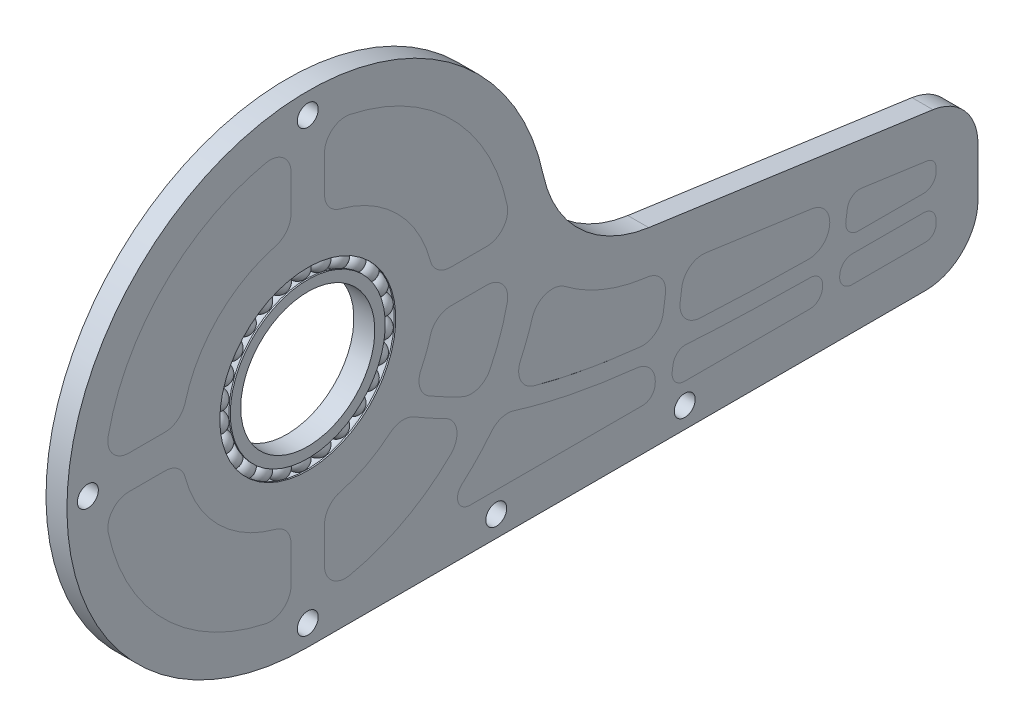
from build123d import *
from OCP.BRepFilletAPI import BRepFilletAPI_MakeFillet

# Parameters (mm, degrees)
SKETCH1_R           = 23.5
SKETCH1_R_2         = 2.5
BOSS_EXTRUDE1_DEPTH = 5
CUT_EXTRUDE1_DEPTH  = 171.091886932
FILLET1_R1          = 5
FILLET1_R2          = 3
BOSS_EXTRUDE2_DEPTH = 5
CIRPATTERN1_COUNT   = 26


# Read off the part's stored shape, not the designer's step: Boss-Extrude2
with BuildPart() as part:
    # Sketch1 → Boss-Extrude1 (new body)
    with BuildSketch(Plane(origin=(0, 0, 0), x_dir=(0, 0, -1), z_dir=(1, 0, 0))):
        with BuildLine():
            Line((0, -57.5), (147.5, -57.5))
            ThreePointArc((147.5, -57.5), (156.338834765, -53.838834765), (160, -45))
            Line((160, -45), (160, -33.365178619))
            ThreePointArc((160, -33.365178619), (156.934208165, -25.164830072), (149.240685392, -20.986971383))
            Line((149.240685392, -20.986971383), (81.395536862, -11.446247371))
            ThreePointArc((81.395536862, -11.446247371), (65.121194516, -3.68658445), (56.233805186, 12.000381425))
            ThreePointArc((56.233805186, 12.000381425), (-44.700514158, 36.16785913), (0, -57.5))
        make_face()
        Circle(SKETCH1_R, mode=Mode.SUBTRACT)
        with Locations((0, 52.5)):
            Circle(SKETCH1_R_2, mode=Mode.SUBTRACT)
        with Locations((-52.5, 0)):
            Circle(SKETCH1_R_2, mode=Mode.SUBTRACT)
        with Locations((0, -52.5)):
            Circle(SKETCH1_R_2, mode=Mode.SUBTRACT)
        with Locations((45, -52.5)):
            Circle(SKETCH1_R_2, mode=Mode.SUBTRACT)
        with Locations((90, -52.5)):
            Circle(SKETCH1_R_2, mode=Mode.SUBTRACT)
    extrude(amount=BOSS_EXTRUDE1_DEPTH)

    # Sketch2 → Cut-Extrude1 (cut, through all)
    with BuildSketch(Plane(origin=(5, 0, 0), x_dir=(0, 0, -1), z_dir=(1, 0, 0))):
        with BuildLine():
            ThreePointArc((22.185246346, -20.586763819), (13.912908948, -26.878075909), (4, -30))
            Line((4, -30), (4, -48.5))
            ThreePointArc((4, -48.5), (23.432821368, -42.651528492), (38.790670249, -29.385947349))
            add(Edge.make_bspline(
                [(38.790670249, -29.385947349), (38.208277868, -29.138826897), (37.04735221, -28.634254689), (33.613250417, -27.069615417), (29.274833218, -24.860974129), (24.928400153, -22.320548454), (22.810244388, -20.988202917), (22.185246346, -20.586763819)],
                knots=[0.667204069, 0.667204069, 0.667204069, 0.667204069, 0.681111736, 0.695019404, 0.75, 0.787250705, 0.802875705, 0.802875705, 0.802875705, 0.802875705], degree=3))
        make_face()
        with BuildLine():
            add(Edge.make_bspline(
                [(41.120637072, -26.025818082), (40.546652129, -25.787609064), (39.402827933, -25.301001665), (35.833175383, -23.706675572), (31.540190896, -21.541218104), (27.246972835, -19.043482716), (25.325200598, -17.84518612), (24.721080246, -17.460475122)],
                knots=[0.660871723, 0.660871723, 0.660871723, 0.660871723, 0.675055768, 0.689239813, 0.75, 0.784024564, 0.799649564, 0.799649564, 0.799649564, 0.799649564], degree=3))
            ThreePointArc((41.120637072, -26.025818082), (46.143784119, -15.45966323), (48.5, -4))
            Line((48.5, -4), (30, -4))
            ThreePointArc((30, -4), (28.176146888, -11.050101654), (24.721080246, -17.460475122))
        make_face()
        with BuildLine():
            Line((30, 4), (48.201922205, 4))
            Line((48.201922205, 4), (48.5, 4))
            ThreePointArc((48.5, 4), (34.41111739, 34.41111739), (4, 48.5))
            Line((4, 48.5), (4, 30))
            ThreePointArc((4, 30), (21.400934559, 21.400934559), (30, 4))
        make_face()
        with BuildLine():
            ThreePointArc((45.879697443, -32.11001966), (38.546027668, -40.622699947), (29.6605799, -47.5))
            Line((29.6605799, -47.5), (82.519678579, -47.5))
            Line((82.519678579, -47.5), (83.638752831, -39.542138653))
            add(Edge.make_bspline(
                [(83.638752831, -39.542138653), (82.136627814, -39.407732053), (74.115556507, -38.620412405), (61.898724071, -36.757253444), (51.310285462, -33.943549975), (46.479451728, -32.317463696), (45.879697443, -32.11001966)],
                knots=[0.346672188, 0.346672188, 0.346672188, 0.346672188, 0.375, 0.5, 0.597665733, 0.6115734, 0.6115734, 0.6115734, 0.6115734], degree=3))
        make_face()
        with BuildLine():
            Line((87.5930026, -39.867473629), (86.519678579, -47.5))
            Line((86.519678579, -47.5), (122.480321421, -47.5))
            Line((122.480321421, -47.5), (123.379214774, -41.107869489))
            add(Edge.make_bspline(
                [(123.379214774, -41.107869489), (123.309909416, -41.107243691), (119.069012377, -41.068607323), (110.949562787, -40.952647021), (99.651727414, -40.60714539), (92.047864376, -40.193028013), (88.114578612, -39.906787388), (87.5930026, -39.867473629)],
                knots=[0.123962248, 0.123962248, 0.123962248, 0.123962248, 0.125, 0.1875, 0.25, 0.3125, 0.322106441, 0.322106441, 0.322106441, 0.322106441], degree=3))
        make_face()
        with BuildLine():
            add(Edge.make_bspline(
                [(84.196491813, -35.575994784), (82.647837316, -35.438625592), (74.684695363, -34.660281607), (63.048861545, -32.88222555), (53.085222246, -30.275299461), (48.711109914, -28.846362296), (48.118024667, -28.647088894)],
                knots=[0.345388461, 0.345388461, 0.345388461, 0.345388461, 0.375, 0.5, 0.589951496, 0.604135542, 0.604135542, 0.604135542, 0.604135542], degree=3))
            Line((84.196491813, -35.575994784), (86.077071858, -22.202981125))
            Line((86.077071858, -22.202981125), (80.002988548, -21.34881316))
            ThreePointArc((80.002988548, -21.34881316), (66.51040029, -16.904021152), (55.422178193, -8.023849723))
            ThreePointArc((55.422178193, -8.023849723), (52.787052395, -18.695643863), (48.118024667, -28.647088894))
        make_face()
        with BuildLine():
            Line((89.999504226, -22.754573177), (88.151196988, -35.898091313))
            add(Edge.make_bspline(
                [(123.94103929, -37.112672931), (123.696247868, -37.110561437), (119.287195408, -37.071300928), (111.033523944, -36.953360628), (99.8147399, -36.610105812), (92.380317535, -36.205001573), (88.580803362, -35.930099221), (88.151196988, -35.898091313)],
                knots=[0.121334068, 0.121334068, 0.121334068, 0.121334068, 0.125, 0.1875, 0.25, 0.3125, 0.320505317, 0.320505317, 0.320505317, 0.320505317], degree=3))
            Line((123.94103929, -37.112672931), (125.262801588, -27.713474368))
            Line((125.262801588, -27.713474368), (89.999504226, -22.754573177))
        make_face()
        with BuildLine():
            Line((127.414275447, -41.138422271), (126.519678579, -47.5))
            Line((126.519678579, -47.5), (147.5, -47.5))
            ThreePointArc((147.5, -47.5), (149.267766953, -46.767766953), (150, -45))
            Line((150, -45), (150, -41.182589309))
            add(Edge.make_bspline(
                [(150, -41.182589309), (148.812824417, -41.182589309), (146.423466184, -41.182589324), (141.76480628, -41.181393352), (136.080016811, -41.17541248), (130.968491752, -41.158687842), (128.116800073, -41.142792862), (127.414275447, -41.138422271)],
                knots=[0, 0, 0, 0, 0.015625, 0.03125, 0.0625, 0.09375, 0.104041802, 0.104041802, 0.104041802, 0.104041802], degree=3))
        make_face()
        with BuildLine():
            Line((129.223827903, -28.270493694), (127.976307043, -37.141753144))
            add(Edge.make_bspline(
                [(150, -37.182589309), (148.812993791, -37.182589309), (146.423722347, -37.182589295), (141.767251686, -37.181393752), (136.087757115, -37.175417046), (131.169092842, -37.159320148), (128.499860489, -37.144838913), (127.976307043, -37.141753144)],
                knots=[0, 0, 0, 0, 0.015625, 0.03125, 0.0625, 0.09375, 0.101416179, 0.101416179, 0.101416179, 0.101416179], degree=3))
            Line((150, -37.182589309), (150, -33.365178619))
            ThreePointArc((150, -33.365178619), (149.386841633, -31.725108909), (147.848137078, -30.889537172))
            Line((147.848137078, -30.889537172), (129.223827903, -28.270493694))
        make_face()
        with BuildLine():
            ThreePointArc((-4, -30), (-21.400934559, -21.400934559), (-30, -4))
            Line((-30, -4), (-48.5, -4))
            ThreePointArc((-48.5, -4), (-34.41111739, -34.41111739), (-4, -48.5))
            Line((-4, -48.5), (-4, -30))
        make_face()
        with BuildLine():
            ThreePointArc((-30, 4), (-21.400934559, 21.400934559), (-4, 30))
            Line((-4, 30), (-4, 48.5))
            ThreePointArc((-4, 48.5), (-34.41111739, 34.41111739), (-48.5, 4))
            Line((-48.5, 4), (-30, 4))
        make_face()
    extrude(amount=-CUT_EXTRUDE1_DEPTH, mode=Mode.SUBTRACT)

    # Fillet1: one fillet with a radius per group of edges: ONE call of the kernel's fillet builder (fillet() takes one radius for all edges)
    fillet1_edges_1 = [part.edges().sort_by_distance(p)[0] for p in [
        (2.5, 48.5, 4),
        (2.5, 4, 48.5),
        (2.5, 4, 30),
        (2.5, 30, 4),
        (2.5, 48.5, -4),
        (2.5, 30, -4),
        (2.5, 4, -48.5),
        (2.5, 4, -30),
        (2.5, -4, -30),
        (2.5, -4, -48.5),
        (2.5, -4, 48.5),
        (2.5, -4, 30),
        (2.5, -30, 4),
        (2.5, -29.385947349, -38.790670249),
        (2.5, -20.586763819, -22.185246346),
        (2.5, -48.5, -4),
        (2.5, -48.5, 4),
        (2.5, -32.11001966, -45.879697443),
        (2.5, -8.023849723, -55.422178193),
        (2.5, -22.202981125, -86.077071858),
        (2.5, -28.647088894, -48.118024667),
        (2.5, -35.575994784, -84.196491813),
        (2.5, -35.898091313, -88.151196988),
        (2.5, -27.713474368, -125.262801588),
        (2.5, -37.112672931, -123.94103929),
        (2.5, -22.754573177, -89.999504226),
        (2.5, -39.542138653, -83.638752831),
        (2.5, -30, -4),
        (2.5, -17.460475122, -24.721080246),
        (2.5, -26.025818082, -41.120637072),
    ]]
    fillet1_edges_2 = [part.edges().sort_by_distance(p)[0] for p in [
        (2.5, -47.5, -29.6605799),
        (2.5, -47.5, -82.519678579),
        (2.5, -39.867473629, -87.5930026),
        (2.5, -47.5, -86.519678579),
        (2.5, -41.107869489, -123.379214774),
        (2.5, -47.5, -122.480321421),
        (2.5, -41.138422271, -127.414275447),
        (2.5, -47.5, -126.519678579),
        (2.5, -28.270493694, -129.223827903),
        (2.5, -37.141753144, -127.976307043),
        (2.5, -37.182589309, -150),
        (2.5, -41.182589309, -150),
    ]]
    fillet1 = BRepFilletAPI_MakeFillet(part.part.solid().wrapped)
    for e in fillet1_edges_1:
        fillet1.Add(FILLET1_R1, e.wrapped)
    for e in fillet1_edges_2:
        fillet1.Add(FILLET1_R2, e.wrapped)
    add(Compound.cast(fillet1.Shape()), mode=Mode.REPLACE)

    # Sketch4 → Revolve3 (revolve)
    with BuildSketch(Plane.XY, mode=Mode.PRIVATE) as revolve3_sk:
        with BuildLine():
            ThreePointArc((0.334936491, 18.5), (2.5, 17.25), (4.665063509, 18.5))
            Line((4.665063509, 18.5), (5, 18.5))
            Line((5, 18.5), (5, 16))
            Line((5, 16), (0, 16))
            Line((0, 16), (0, 18.5))
            Line((0, 18.5), (0.334936491, 18.5))
        make_face()
        with BuildLine():
            ThreePointArc((4.665063509, 21), (2.5, 22.25), (0.334936491, 21))
            Line((0.334936491, 21), (0, 21))
            Line((0, 21), (0, 23.5))
            Line((0, 23.5), (5, 23.5))
            Line((5, 23.5), (5, 21))
            Line((5, 21), (4.665063509, 21))
        make_face()
    revolve(revolve3_sk.sketch.rotate(Axis((0, 0, 0), (1, 0, 0)), 90), axis=Axis((0, 0, 0), (1, 0, 0)))


with BuildPart() as body_2:
    # Boss-Extrude2 outline → Boss-Extrude2 (new body)
    with BuildSketch(Plane(origin=(0, 0, 0), x_dir=(0, 0, -1), z_dir=(1, 0, 0))):
        with BuildLine():
            ThreePointArc((127.000301711, -44.082235506), (127.706861488, -46.468083651), (129.971071448, -47.5))
            Line((129.971071448, -47.5), (147.5, -47.5))
            ThreePointArc((147.5, -47.5), (149.267766953, -46.767766953), (150, -45))
            Line((150, -45), (150, -44.182500207))
            ThreePointArc((150, -44.182500207), (149.121415194, -42.061274718), (147.000268283, -41.182500219))
            add(Edge.make_bspline(
                [(147.000268283, -41.182500219), (146.812686203, -41.182483444), (145.443341439, -41.182337706), (141.76480628, -41.181393352), (136.255555018, -41.175597161), (132.030232477, -41.162146761), (130.034095757, -41.152710267)],
                knots=[0.013149231, 0.013149231, 0.013149231, 0.013149231, 0.015625, 0.03125, 0.0625, 0.091337611, 0.091337611, 0.091337611, 0.091337611], degree=3))
            ThreePointArc((130.034095757, -41.152710267), (128.057187471, -41.883821212), (127.049144044, -43.734912251))
            Line((127.049144044, -43.734912251), (127.000301711, -44.082235506))
        make_face()
        with BuildLine():
            Line((89.971071448, -47.5), (119.872678552, -47.5))
            ThreePointArc((119.872678552, -47.5), (121.840762204, -46.76420996), (122.843448289, -44.917764494))
            Line((122.843448289, -44.917764494), (122.903627951, -44.489820231))
            ThreePointArc((122.903627951, -44.489820231), (122.208769003, -42.117514849), (119.968652158, -41.072269279))
            add(Edge.make_bspline(
                [(119.968652158, -41.072269279), (116.930598371, -41.036018723), (109.976696211, -40.922895571), (100.092777534, -40.620633242), (93.419117385, -40.267091683), (90.372954412, -40.064496339)],
                knots=[0.14114579, 0.14114579, 0.14114579, 0.14114579, 0.1875, 0.25, 0.305180288, 0.305180288, 0.305180288, 0.305180288], degree=3))
            ThreePointArc((90.372954412, -40.064496339), (88.282040284, -40.729582629), (87.203099383, -42.64011873))
            Line((87.203099383, -42.64011873), (87.000301711, -44.082235506))
            ThreePointArc((87.000301711, -44.082235506), (87.706861488, -46.468083651), (89.971071448, -47.5))
        make_face()
        with BuildLine():
            Line((38.73951471, -47.5), (79.91203571, -47.5))
            ThreePointArc((79.91203571, -47.5), (81.880119362, -46.76420996), (82.882805447, -44.917764494))
            Line((82.882805447, -44.917764494), (82.913898967, -44.696655021))
            ThreePointArc((82.913898967, -44.696655021), (81.911175874, -40.932991828), (78.51236968, -39.030695665))
            add(Edge.make_bspline(
                [(78.51236968, -39.030695665), (72.309256976, -38.344498563), (62.27249356, -36.793159127), (52.985980437, -34.385427724), (49.222984389, -33.209816183)],
                knots=[0.379394701, 0.379394701, 0.379394701, 0.379394701, 0.5, 0.585926939, 0.585926939, 0.585926939, 0.585926939], degree=3))
            ThreePointArc((49.222984389, -33.209816183), (46.264295939, -33.202595877), (43.819526871, -34.869027299))
            ThreePointArc((43.819526871, -34.869027299), (40.46268709, -38.713963287), (36.769708878, -42.237288136))
            ThreePointArc((36.769708878, -42.237288136), (35.929876336, -45.551633112), (38.73951471, -47.5))
        make_face()
        with BuildLine():
            Line((150, -34.182500163), (150, -33.365178619))
            ThreePointArc((150, -33.365178619), (149.386841633, -31.725108909), (147.848137078, -30.889537172))
            Line((147.848137078, -30.889537172), (132.19459764, -28.688258188))
            ThreePointArc((132.19459764, -28.688258188), (129.971585827, -29.262972392), (128.806063409, -31.24126343))
            Line((128.806063409, -31.24126343), (128.454541654, -33.74097369))
            ThreePointArc((128.454541654, -33.74097369), (129.157125744, -36.122238598), (131.413176817, -37.158713643))
            add(Edge.make_bspline(
                [(131.413176817, -37.158713643), (132.964881549, -37.164990119), (136.738536803, -37.176101881), (141.767251686, -37.181393752), (145.443755956, -37.18233769), (146.812493402, -37.182483398), (146.999731573, -37.182500151)],
                knots=[0.013153288, 0.013153288, 0.013153288, 0.013153288, 0.035451406, 0.066701406, 0.082326406, 0.084798118, 0.084798118, 0.084798118, 0.084798118], degree=3))
            ThreePointArc((146.999731573, -37.182500151), (149.121225438, -36.303915408), (150, -34.182500163))
        make_face()
        with BuildLine():
            Line((124.552654082, -32.763412189), (124.566527431, -32.664757263))
            ThreePointArc((124.566527431, -32.664757263), (123.608670425, -28.959737573), (120.311518694, -27.017200211))
            Line((120.311518694, -27.017200211), (94.95078712, -23.450847334))
            ThreePointArc((94.95078712, -23.450847334), (91.245767431, -24.40870434), (89.303230069, -27.705856071))
            Line((89.303230069, -27.705856071), (88.900856811, -30.567177017))
            ThreePointArc((88.900856811, -30.567177017), (89.985118561, -34.433016992), (93.562888485, -36.255077535))
            add(Edge.make_bspline(
                [(93.562888485, -36.255077535), (95.645334652, -36.375749647), (101.312204101, -36.655922881), (109.9215952, -36.91933957), (116.679734901, -37.031346079), (119.539466767, -37.066754802)],
                knots=[0.143583711, 0.143583711, 0.143583711, 0.143583711, 0.18105653, 0.24355653, 0.287472819, 0.287472819, 0.287472819, 0.287472819], degree=3))
            ThreePointArc((119.539466767, -37.066754802), (122.858086538, -35.86105489), (124.552654082, -32.763412189))
        make_face()
        with BuildLine():
            Line((81.125788964, -21.506706968), (80.002988548, -21.34881316))
            ThreePointArc((80.002988548, -21.34881316), (70.218668397, -18.674155024), (61.421707918, -13.624382426))
            ThreePointArc((61.421707918, -13.624382426), (56.854417413, -12.85589305), (53.615661085, -16.166659718))
            ThreePointArc((53.615661085, -16.166659718), (52.345035582, -19.899679643), (50.814856037, -23.534026557))
            ThreePointArc((50.814856037, -23.534026557), (50.813374255, -27.733328861), (54.013210489, -30.452738745))
            add(Edge.make_bspline(
                [(54.013210489, -30.452738745), (56.511617504, -31.147001548), (64.503556907, -33.097971644), (73.121226203, -34.421311833), (79.372600536, -35.101053847)],
                knots=[0.376625329, 0.376625329, 0.376625329, 0.376625329, 0.43449557, 0.557870241, 0.557870241, 0.557870241, 0.557870241], degree=3))
            ThreePointArc((79.372600536, -35.101053847), (82.98415693, -34.076051454), (84.864371713, -30.826626603))
            Line((84.864371713, -30.826626603), (85.380797701, -27.154264019))
            ThreePointArc((85.380797701, -27.154264019), (84.422940695, -23.44924433), (81.125788964, -21.506706968))
        make_face()
        with BuildLine():
            ThreePointArc((-47.61971687, -10.0305815), (-34.41111739, -34.41111739), (-10.0305815, -47.61971687))
            ThreePointArc((-10.0305815, -47.61971687), (-5.849833933, -46.609920301), (-4, -42.727079363))
            Line((-4, -42.727079363), (-4, -34.097726009))
            ThreePointArc((-4, -34.097726009), (-5.038928508, -31.046511064), (-7.723965056, -29.263293797))
            ThreePointArc((-7.723965056, -29.263293797), (-21.400934559, -21.400934559), (-29.263293797, -7.723965056))
            ThreePointArc((-29.263293797, -7.723965056), (-31.046511064, -5.038928508), (-34.097726009, -4))
            Line((-34.097726009, -4), (-42.727079363, -4))
            ThreePointArc((-42.727079363, -4), (-46.609920301, -5.849833933), (-47.61971687, -10.0305815))
        make_face()
        with BuildLine():
            ThreePointArc((10.0305815, -47.61971687), (23.006224156, -42.883139461), (34.128327556, -34.691602129))
            ThreePointArc((34.128327556, -34.691602129), (35.559721465, -30.341494752), (32.848768838, -26.650551976))
            add(Edge.make_bspline(
                [(32.848768838, -26.650551976), (31.413241176, -25.936452988), (28.92150774, -24.62767543), (26.453145204, -23.207625264), (25.400791824, -22.579226637)],
                knots=[0.715007628, 0.715007628, 0.715007628, 0.715007628, 0.75, 0.776154556, 0.776154556, 0.776154556, 0.776154556], degree=3))
            ThreePointArc((25.400791824, -22.579226637), (22.422590157, -21.889337831), (19.599438982, -23.062133284))
            ThreePointArc((19.599438982, -23.062133284), (14.009129165, -26.828050619), (7.723965056, -29.263293797))
            ThreePointArc((7.723965056, -29.263293797), (5.038928508, -31.046511064), (4, -34.097726009))
            Line((4, -34.097726009), (4, -42.727079363))
            ThreePointArc((4, -42.727079363), (5.849833933, -46.609920301), (10.0305815, -47.61971687))
        make_face()
        with BuildLine():
            ThreePointArc((43.470458548, -21.876225306), (45.928584059, -16.087733411), (47.61971687, -10.0305815))
            ThreePointArc((47.61971687, -10.0305815), (46.609920301, -5.849833933), (42.727079363, -4))
            Line((42.727079363, -4), (34.097726009, -4))
            ThreePointArc((34.097726009, -4), (31.046511064, -5.038928508), (29.263293797, -7.723965056))
            ThreePointArc((29.263293797, -7.723965056), (28.319488967, -10.67738473), (27.078470008, -13.51874484))
            ThreePointArc((27.078470008, -13.51874484), (26.765470141, -17.197622518), (29.062468052, -20.088281696))
            add(Edge.make_bspline(
                [(29.062468052, -20.088281696), (29.543171425, -20.364263669), (32.128533422, -21.8221752), (34.737633759, -23.15259074), (36.885206954, -24.157389595)],
                knots=[0.696055038, 0.696055038, 0.696055038, 0.696055038, 0.708398801, 0.762343763, 0.762343763, 0.762343763, 0.762343763], degree=3))
            ThreePointArc((36.885206954, -24.157389595), (40.640744743, -24.353139054), (43.470458548, -21.876225306))
        make_face()
        with BuildLine():
            ThreePointArc((47.61971687, 10.0305815), (34.41111739, 34.41111739), (10.0305815, 47.61971687))
            ThreePointArc((10.0305815, 47.61971687), (5.849833933, 46.609920301), (4, 42.727079363))
            Line((4, 42.727079363), (4, 34.097726009))
            ThreePointArc((4, 34.097726009), (5.038928508, 31.046511064), (7.723965056, 29.263293797))
            ThreePointArc((7.723965056, 29.263293797), (21.400934559, 21.400934559), (29.263293797, 7.723965056))
            ThreePointArc((29.263293797, 7.723965056), (31.046511064, 5.038928508), (34.097726009, 4))
            Line((34.097726009, 4), (42.727079363, 4))
            ThreePointArc((42.727079363, 4), (46.609920301, 5.849833933), (47.61971687, 10.0305815))
        make_face()
        with BuildLine():
            ThreePointArc((-10.0305815, 47.61971687), (-34.41111739, 34.41111739), (-47.61971687, 10.0305815))
            ThreePointArc((-47.61971687, 10.0305815), (-46.609920301, 5.849833933), (-42.727079363, 4))
            Line((-42.727079363, 4), (-34.097726009, 4))
            ThreePointArc((-34.097726009, 4), (-31.046511064, 5.038928508), (-29.263293797, 7.723965056))
            ThreePointArc((-29.263293797, 7.723965056), (-21.400934559, 21.400934559), (-7.723965056, 29.263293797))
            ThreePointArc((-7.723965056, 29.263293797), (-5.038928508, 31.046511064), (-4, 34.097726009))
            Line((-4, 34.097726009), (-4, 42.727079363))
            ThreePointArc((-4, 42.727079363), (-5.849833933, 46.609920301), (-10.0305815, 47.61971687))
        make_face()
    extrude(amount=BOSS_EXTRUDE2_DEPTH)


with BuildPart() as revolve3_piece_1:
    # of the separate pieces the step leaves, piece 1, a body of its own (revolve3_pieces)
    add(part.part.solids().sort_by_distance((0, -29.263293797, -7.723965056))[0])


with BuildPart() as revolve3_piece_2:
    # of the separate pieces the step leaves, piece 2, a body of its own (revolve3_pieces)
    add(part.part.solids().sort_by_distance((0.334936491, 0, 18.5))[0])


with BuildPart() as body_4:
    # Sketch5 → Revolve9 (revolve)
    with BuildSketch(Plane.XY):
        with BuildLine():
            Line((4.85, 19.75), (0.15, 19.75))
            ThreePointArc((0.15, 19.75), (2.5, 17.4), (4.85, 19.75))
        make_face()
    revolve(axis=Axis((2.5, 19.75, 0), (1, 0, 0)))


with BuildPart() as cirpattern1_1:
    # CirPattern1: pattern copy
    add(body_4.part.rotate(Axis((0, 0, 0), (1, 0, 0)), 1 * 360 / CIRPATTERN1_COUNT))


with BuildPart() as cirpattern1_2:
    # CirPattern1: pattern copy
    add(body_4.part.rotate(Axis((0, 0, 0), (1, 0, 0)), 2 * 360 / CIRPATTERN1_COUNT))


with BuildPart() as cirpattern1_3:
    # CirPattern1: pattern copy
    add(body_4.part.rotate(Axis((0, 0, 0), (1, 0, 0)), 3 * 360 / CIRPATTERN1_COUNT))


with BuildPart() as cirpattern1_4:
    # CirPattern1: pattern copy
    add(body_4.part.rotate(Axis((0, 0, 0), (1, 0, 0)), 4 * 360 / CIRPATTERN1_COUNT))


with BuildPart() as cirpattern1_5:
    # CirPattern1: pattern copy
    add(body_4.part.rotate(Axis((0, 0, 0), (1, 0, 0)), 5 * 360 / CIRPATTERN1_COUNT))


with BuildPart() as cirpattern1_6:
    # CirPattern1: pattern copy
    add(body_4.part.rotate(Axis((0, 0, 0), (1, 0, 0)), 6 * 360 / CIRPATTERN1_COUNT))


with BuildPart() as cirpattern1_7:
    # CirPattern1: pattern copy
    add(body_4.part.rotate(Axis((0, 0, 0), (1, 0, 0)), 7 * 360 / CIRPATTERN1_COUNT))


with BuildPart() as cirpattern1_8:
    # CirPattern1: pattern copy
    add(body_4.part.rotate(Axis((0, 0, 0), (1, 0, 0)), 8 * 360 / CIRPATTERN1_COUNT))


with BuildPart() as cirpattern1_9:
    # CirPattern1: pattern copy
    add(body_4.part.rotate(Axis((0, 0, 0), (1, 0, 0)), 9 * 360 / CIRPATTERN1_COUNT))


with BuildPart() as cirpattern1_10:
    # CirPattern1: pattern copy
    add(body_4.part.rotate(Axis((0, 0, 0), (1, 0, 0)), 10 * 360 / CIRPATTERN1_COUNT))


with BuildPart() as cirpattern1_11:
    # CirPattern1: pattern copy
    add(body_4.part.rotate(Axis((0, 0, 0), (1, 0, 0)), 11 * 360 / CIRPATTERN1_COUNT))


with BuildPart() as cirpattern1_12:
    # CirPattern1: pattern copy
    add(body_4.part.rotate(Axis((0, 0, 0), (1, 0, 0)), 12 * 360 / CIRPATTERN1_COUNT))


with BuildPart() as cirpattern1_13:
    # CirPattern1: pattern copy
    add(body_4.part.rotate(Axis((0, 0, 0), (1, 0, 0)), 13 * 360 / CIRPATTERN1_COUNT))


with BuildPart() as cirpattern1_14:
    # CirPattern1: pattern copy
    add(body_4.part.rotate(Axis((0, 0, 0), (1, 0, 0)), 14 * 360 / CIRPATTERN1_COUNT))


with BuildPart() as cirpattern1_15:
    # CirPattern1: pattern copy
    add(body_4.part.rotate(Axis((0, 0, 0), (1, 0, 0)), 15 * 360 / CIRPATTERN1_COUNT))


with BuildPart() as cirpattern1_16:
    # CirPattern1: pattern copy
    add(body_4.part.rotate(Axis((0, 0, 0), (1, 0, 0)), 16 * 360 / CIRPATTERN1_COUNT))


with BuildPart() as cirpattern1_17:
    # CirPattern1: pattern copy
    add(body_4.part.rotate(Axis((0, 0, 0), (1, 0, 0)), 17 * 360 / CIRPATTERN1_COUNT))


with BuildPart() as cirpattern1_18:
    # CirPattern1: pattern copy
    add(body_4.part.rotate(Axis((0, 0, 0), (1, 0, 0)), 18 * 360 / CIRPATTERN1_COUNT))


with BuildPart() as cirpattern1_19:
    # CirPattern1: pattern copy
    add(body_4.part.rotate(Axis((0, 0, 0), (1, 0, 0)), 19 * 360 / CIRPATTERN1_COUNT))


with BuildPart() as cirpattern1_20:
    # CirPattern1: pattern copy
    add(body_4.part.rotate(Axis((0, 0, 0), (1, 0, 0)), 20 * 360 / CIRPATTERN1_COUNT))


with BuildPart() as cirpattern1_21:
    # CirPattern1: pattern copy
    add(body_4.part.rotate(Axis((0, 0, 0), (1, 0, 0)), 21 * 360 / CIRPATTERN1_COUNT))


with BuildPart() as cirpattern1_22:
    # CirPattern1: pattern copy
    add(body_4.part.rotate(Axis((0, 0, 0), (1, 0, 0)), 22 * 360 / CIRPATTERN1_COUNT))


with BuildPart() as cirpattern1_23:
    # CirPattern1: pattern copy
    add(body_4.part.rotate(Axis((0, 0, 0), (1, 0, 0)), 23 * 360 / CIRPATTERN1_COUNT))


with BuildPart() as cirpattern1_24:
    # CirPattern1: pattern copy
    add(body_4.part.rotate(Axis((0, 0, 0), (1, 0, 0)), 24 * 360 / CIRPATTERN1_COUNT))


with BuildPart() as cirpattern1_25:
    # CirPattern1: pattern copy
    add(body_4.part.rotate(Axis((0, 0, 0), (1, 0, 0)), 25 * 360 / CIRPATTERN1_COUNT))


solid = Compound([body_2.part, revolve3_piece_1.part, revolve3_piece_2.part, body_4.part, cirpattern1_1.part, cirpattern1_2.part, cirpattern1_3.part, cirpattern1_4.part, cirpattern1_5.part, cirpattern1_6.part, cirpattern1_7.part, cirpattern1_8.part, cirpattern1_9.part, cirpattern1_10.part, cirpattern1_11.part, cirpattern1_12.part, cirpattern1_13.part, cirpattern1_14.part, cirpattern1_15.part, cirpattern1_16.part, cirpattern1_17.part, cirpattern1_18.part, cirpattern1_19.part, cirpattern1_20.part, cirpattern1_21.part, cirpattern1_22.part, cirpattern1_23.part, cirpattern1_24.part, cirpattern1_25.part])
